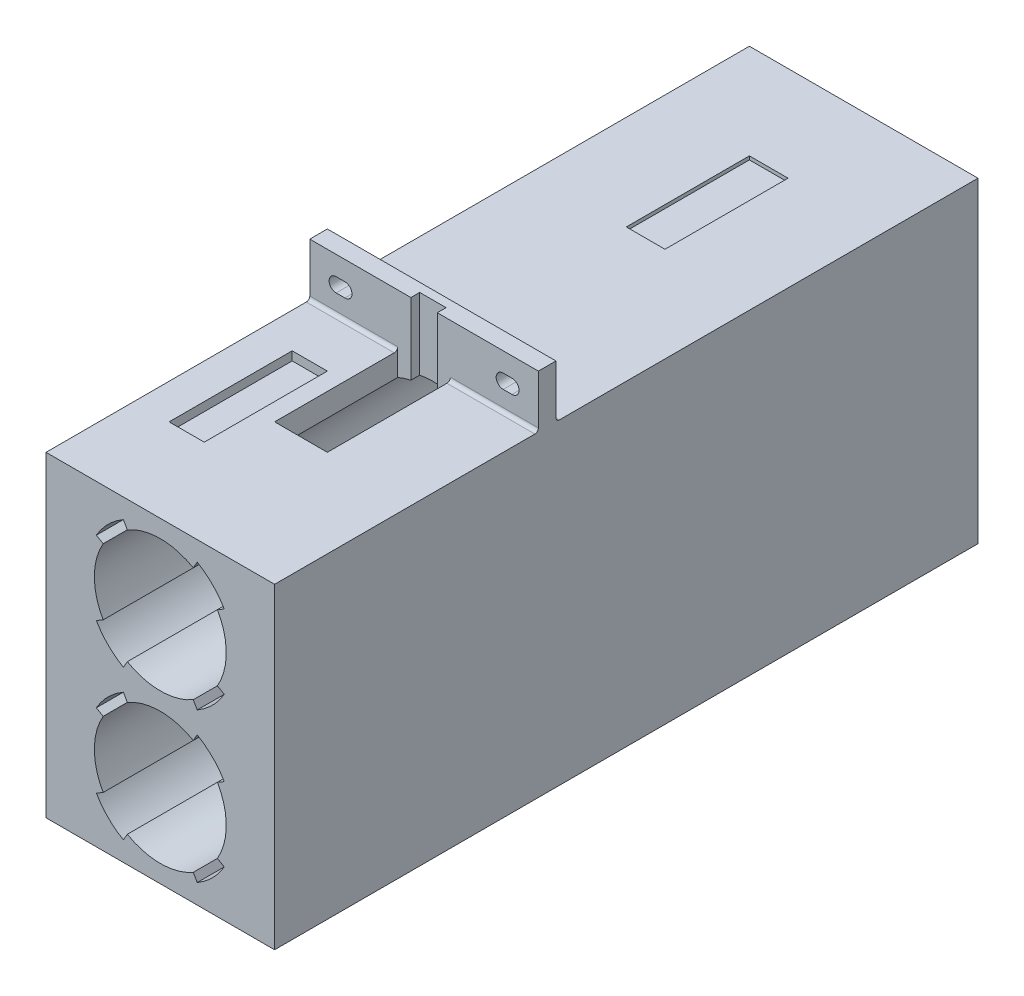
from build123d import *

# Parameters (mm, degrees)
SKETCH_1_W               = 130
SKETCH_1_H               = 180
EXTRUDE_1_DEPTH          = 400
SKETCH_2_R               = 37.5
CUT_EXTRUDE_1_DEPTH      = 458.493169348
CUT_EXTRUDE_4_REACH      = 459.493
SKETCH_11_W              = 30
SKETCH_11_H              = 70
SKETCH_12_W              = 20
SKETCH_12_H              = 70
CUT_EXTRUDE_5_DEPTH      = 5
SKETCH_13_W              = 22
SKETCH_13_H              = 70
CUT_EXTRUDE_6_DEPTH      = 2
SKETCH_14_W              = 130
SKETCH_14_H              = 10
EXTRUDE_6_DEPTH          = 30
CUT_EXTRUDE_7_REACH      = 353.426
CUT_EXTRUDE_8_REACH      = 472.106
CUT_EXTRUDE_8_END_RADIUS = 37.5
SKETCH_16_W              = 15
SKETCH_16_H              = 5
FILLET_1_R               = 2
CUT_EXTRUDE_9_DEPTH      = 471.106370942


with BuildPart() as part:
    # 草圖1 → 填料-伸長1 (new body)
    with BuildSketch(Plane.XY):
        with Locations((-65, 90)):
            Rectangle(SKETCH_1_W, SKETCH_1_H)
    extrude(amount=EXTRUDE_1_DEPTH)

    # 草圖2 → 除料-伸長1 (cut, through all)
    with BuildSketch(Plane.XY.offset(400)):
        with Locations((-65, 132.5)):
            Circle(SKETCH_2_R)
        with Locations((-65, 47.5)):
            Circle(SKETCH_2_R)
    extrude(amount=-CUT_EXTRUDE_1_DEPTH, mode=Mode.SUBTRACT)

    # 草圖11 → 除料-伸長4 (cut, up to next)
    with BuildSketch(Plane(origin=(0, 180, 0), x_dir=(1, 0, 0), z_dir=(0, 1, 0)), mode=Mode.PRIVATE) as cut_extrude_4_sk1:
        with Locations((-65, -285)):
            Rectangle(SKETCH_11_W, SKETCH_11_H)
    cut_extrude_4_tool1 = extrude(cut_extrude_4_sk1.sketch, amount=-CUT_EXTRUDE_4_REACH, mode=Mode.PRIVATE) & part.part
    add(cut_extrude_4_tool1.solids().sort_by_distance((-65, 180, 285))[0], mode=Mode.SUBTRACT)

    # 草圖12 → 除料-伸長5 (cut)
    with BuildSketch(Plane(origin=(0, 180, 0), x_dir=(1, 0, 0), z_dir=(0, 1, 0))):
        with Locations((-100, -315)):
            Rectangle(SKETCH_12_W, SKETCH_12_H)
    extrude(amount=-CUT_EXTRUDE_5_DEPTH, mode=Mode.SUBTRACT)

    # 草圖13 → 除料-伸長6 (cut)
    with BuildSketch(Plane(origin=(0, 180, 0), x_dir=(1, 0, 0), z_dir=(0, 1, 0))):
        with Locations((-65, -89)):
            Rectangle(SKETCH_13_W, SKETCH_13_H)
    extrude(amount=-CUT_EXTRUDE_6_DEPTH, mode=Mode.SUBTRACT)

    # 草圖14 → 填料-伸長6 (add)
    with BuildSketch(Plane(origin=(0, 180, 0), x_dir=(1, 0, 0), z_dir=(0, 1, 0))):
        with Locations((-65, -245)):
            Rectangle(SKETCH_14_W, SKETCH_14_H)
    extrude(amount=EXTRUDE_6_DEPTH)

    # 草圖15 → 除料-伸長7 (cut, up to next)
    with BuildSketch(Plane.XY.offset(250), mode=Mode.PRIVATE) as cut_extrude_7_sk1:
        with BuildLine():
            Line((-115.000000592, 191), (-110.000000592, 191))
            ThreePointArc((-110.000000592, 191), (-105.999999811, 194.999999609), (-109.999999811, 199))
            Line((-109.999999811, 199), (-114.999999811, 199))
            ThreePointArc((-114.999999811, 199), (-119, 195.000000391), (-115.000000592, 191))
        make_face()
    cut_extrude_7_tool1 = extrude(cut_extrude_7_sk1.sketch, amount=-CUT_EXTRUDE_7_REACH, mode=Mode.PRIVATE) & part.part
    # 草圖15 → 除料-伸長7 (cut, up to next)
    with BuildSketch(Plane.XY.offset(250), mode=Mode.PRIVATE) as cut_extrude_7_sk2:
        with BuildLine():
            Line((-14.999999408, 191), (-19.999999408, 191))
            ThreePointArc((-19.999999408, 191), (-24.000000189, 194.999999609), (-20.000000189, 199))
            Line((-20.000000189, 199), (-15.000000189, 199))
            ThreePointArc((-15.000000189, 199), (-11, 195.000000391), (-14.999999408, 191))
        make_face()
    cut_extrude_7_tool2 = extrude(cut_extrude_7_sk2.sketch, amount=-CUT_EXTRUDE_7_REACH, mode=Mode.PRIVATE) & part.part
    add(cut_extrude_7_tool1.solids().sort_by_distance((-112.5, 195, 250))[0], mode=Mode.SUBTRACT)
    add(cut_extrude_7_tool2.solids().sort_by_distance((-17.5, 195, 250))[0], mode=Mode.SUBTRACT)

    # 除料-伸長8: up to this cylinder (the profile starts outside it)
    cut_extrude_8_end = Plane(origin=(-65, 132.5, 247.5), z_dir=(0, 0, 1)) * Cylinder(CUT_EXTRUDE_8_END_RADIUS, 1020.212, mode=Mode.PRIVATE)
    # 草圖16 → 除料-伸長8 (cut, up to the surface)
    with BuildSketch(Plane(origin=(0, 210, 0), x_dir=(1, 0, 0), z_dir=(0, 1, 0)), mode=Mode.PRIVATE) as cut_extrude_8_sk1:
        with Locations((-65, -247.5)):
            Rectangle(SKETCH_16_W, SKETCH_16_H)
    cut_extrude_8_tool1 = extrude(cut_extrude_8_sk1.sketch, amount=-CUT_EXTRUDE_8_REACH, mode=Mode.PRIVATE) - cut_extrude_8_end
    add(cut_extrude_8_tool1.solids().sort_by_distance((-65, 210, 247.5))[0], mode=Mode.SUBTRACT)

    # 圓角1
    fillet_1_edges = [part.edges().sort_by_distance(p)[0] for p in [
        (-65, 180, 240),
        (-25, 180, 250),
        (-105, 180, 250),
    ]]
    fillet(fillet_1_edges, radius=FILLET_1_R)

    # 草圖17 → 除料-伸長9 (cut, through all)
    with BuildSketch(Plane.XY.offset(400)):
        with BuildLine():
            Line((-44, 83.873066959), (-46.5, 79.54293994))
            ThreePointArc((-46.5, 79.54293994), (-38.837049096, 73.662950904), (-32.95706006, 66))
            Line((-32.95706006, 66), (-28.626933041, 68.5))
            ThreePointArc((-28.626933041, 68.5), (-35.30151519, 77.19848481), (-44, 83.873066959))
        make_face()
        with BuildLine():
            Line((-44, 168.873066959), (-46.5, 164.54293994))
            ThreePointArc((-46.5, 164.54293994), (-38.837049096, 158.662950904), (-32.95706006, 151))
            Line((-32.95706006, 151), (-28.626933041, 153.5))
            ThreePointArc((-28.626933041, 153.5), (-35.30151519, 162.19848481), (-44, 168.873066959))
        make_face()
        with BuildLine():
            Line((-28.626933041, 111.5), (-32.95706006, 114))
            ThreePointArc((-32.95706006, 114), (-38.837049096, 106.337049096), (-46.5, 100.45706006))
            Line((-46.5, 100.45706006), (-44, 96.126933041))
            ThreePointArc((-44, 96.126933041), (-35.30151519, 102.80151519), (-28.626933041, 111.5))
        make_face()
        with BuildLine():
            Line((-86, 96.126933041), (-83.5, 100.45706006))
            ThreePointArc((-83.5, 100.45706006), (-91.162950904, 106.337049096), (-97.04293994, 114))
            Line((-97.04293994, 114), (-101.373066959, 111.5))
            ThreePointArc((-101.373066959, 111.5), (-94.69848481, 102.80151519), (-86, 96.126933041))
        make_face()
        with BuildLine():
            Line((-101.373066959, 153.5), (-97.04293994, 151))
            ThreePointArc((-97.04293994, 151), (-91.162950904, 158.662950904), (-83.5, 164.54293994))
            Line((-83.5, 164.54293994), (-86, 168.873066959))
            ThreePointArc((-86, 168.873066959), (-94.69848481, 162.19848481), (-101.373066959, 153.5))
        make_face()
        with BuildLine():
            Line((-28.626933041, 26.5), (-32.95706006, 29))
            ThreePointArc((-32.95706006, 29), (-38.837049096, 21.337049096), (-46.5, 15.45706006))
            Line((-46.5, 15.45706006), (-44, 11.126933041))
            ThreePointArc((-44, 11.126933041), (-35.30151519, 17.80151519), (-28.626933041, 26.5))
        make_face()
        with BuildLine():
            Line((-86, 11.126933041), (-83.5, 15.45706006))
            ThreePointArc((-83.5, 15.45706006), (-91.162950904, 21.337049096), (-97.04293994, 29))
            Line((-97.04293994, 29), (-101.373066959, 26.5))
            ThreePointArc((-101.373066959, 26.5), (-94.69848481, 17.80151519), (-86, 11.126933041))
        make_face()
        with BuildLine():
            Line((-101.373066959, 68.5), (-97.04293994, 66))
            ThreePointArc((-97.04293994, 66), (-91.162950904, 73.662950904), (-83.5, 79.54293994))
            Line((-83.5, 79.54293994), (-86, 83.873066959))
            ThreePointArc((-86, 83.873066959), (-94.69848481, 77.19848481), (-101.373066959, 68.5))
        make_face()
    extrude(amount=-CUT_EXTRUDE_9_DEPTH, mode=Mode.SUBTRACT)


solid = part.part
